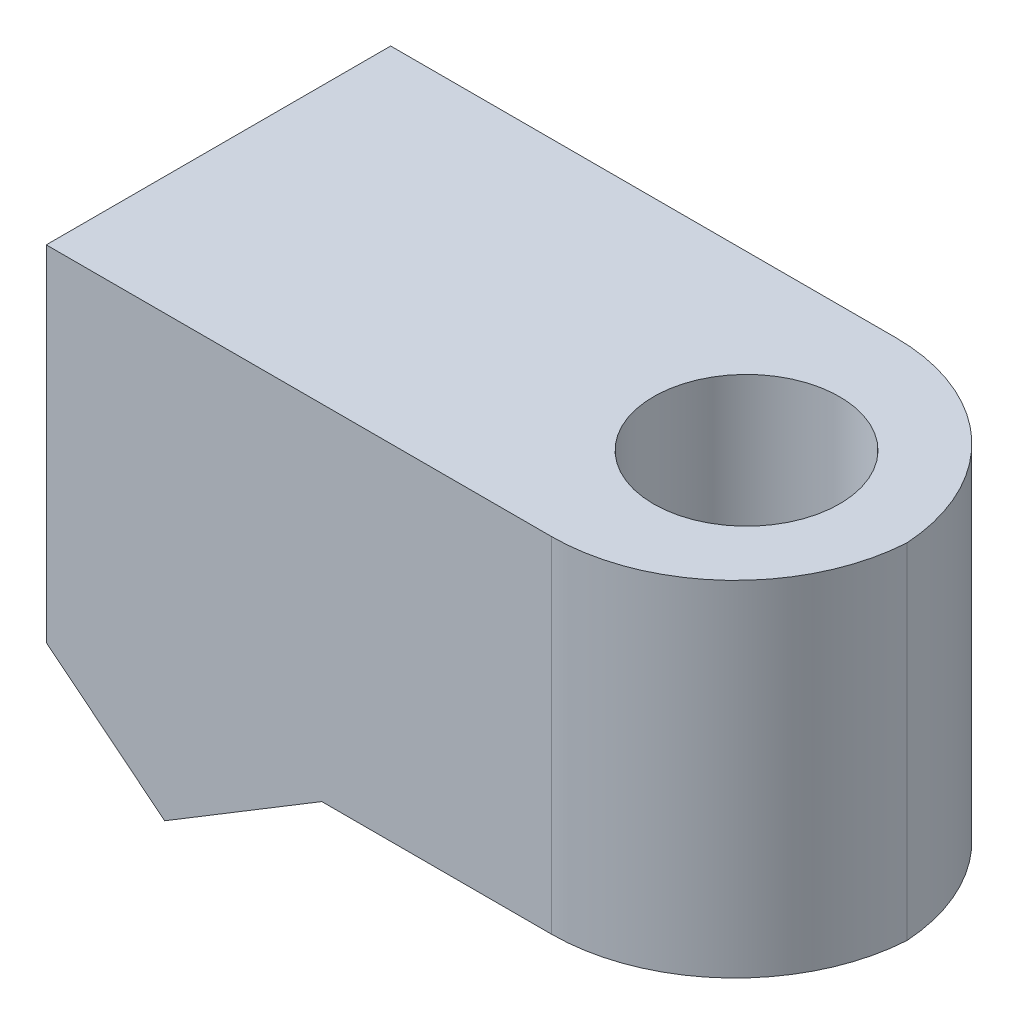
from build123d import *

# Parameters (mm, degrees)
SKETCH1_W           = 30
SKETCH1_H           = 15
SKETCH1_R           = 4.05
BOSS_EXTRUDE1_DEPTH = 15
FILLET1_R           = 8
SKETCH2_W           = 10.1
SKETCH2_H           = 10.1
CUT_EXTRUDE1_DEPTH  = 17
BOSS_EXTRUDE2_DEPTH = 15
CUT_EXTRUDE2_REACH  = 24.191
SKETCH4_R           = 3.2


with BuildPart() as part:
    # Sketch1 → Boss-Extrude1 (new body)
    with BuildSketch(Plane(origin=(0, 0, 0), x_dir=(1, 0, 0), z_dir=(0, 1, 0))):
        Rectangle(SKETCH1_W, SKETCH1_H)
        with Locations(Location((8, 0, 0), (0, 0, 270))):
            Circle(SKETCH1_R, mode=Mode.SUBTRACT)
    extrude(amount=BOSS_EXTRUDE1_DEPTH)

    # Fillet1
    # the kernel refuses this fillet: 8 mm, written as the material it takes off along each edge
    with BuildSketch(Plane(origin=(15, -20, -7.5), x_dir=(-1, 0, 0), z_dir=(0, 1, 0))) as fillet1_piece_1:
        with BuildLine():
            CenterArc((FILLET1_R, FILLET1_R), FILLET1_R, 180, 90)
            Line((0, FILLET1_R), (0, 0))
            Line((0, 0), (FILLET1_R, 0))
        make_face()
    extrude(amount=55, mode=Mode.SUBTRACT)
    with BuildSketch(Plane(origin=(15, -20, 7.5), x_dir=(-1, 0, 0), z_dir=(0, 1, 0))) as fillet1_piece_2:
        with BuildLine():
            CenterArc((FILLET1_R, -FILLET1_R), FILLET1_R, 90, 90)
            Line((0, -FILLET1_R), (0, 0))
            Line((0, 0), (FILLET1_R, 0))
        make_face()
    extrude(amount=55, mode=Mode.SUBTRACT)

    # Sketch2 → Cut-Extrude1 (cut)
    with BuildSketch(Plane.ZY.offset(15)):
        with Locations((0, 7.5)):
            Rectangle(SKETCH2_W, SKETCH2_H)
    extrude(amount=-CUT_EXTRUDE1_DEPTH, mode=Mode.SUBTRACT)

    # Sketch3 → Boss-Extrude2 (add)
    with BuildSketch(Plane.XY.offset(7.5)):
        Polygon((-3, 0), (-9.842158581, -4.145463298), (-15, 0), align=None)
    extrude(amount=-BOSS_EXTRUDE2_DEPTH)

    # Cut-Extrude2: up to this plane
    cut_extrude2_end = Plane(origin=(2, 2.45, 5.05), z_dir=(0, -1, 0))
    # Sketch4 → Cut-Extrude2 (cut, up to the surface)
    with BuildSketch(Plane(origin=(-0.805540592, 1.329558622, 0), x_dir=(0, 0, -1), z_dir=(0.5181829122191232, -0.8552698226198026, 0)), mode=Mode.PRIVATE) as cut_extrude2_sk1:
        with Locations(Location((0, -6.565809468, 0), (0, 0, 90))):
            Circle(SKETCH4_R)
    cut_extrude2_tool1 = split(extrude(cut_extrude2_sk1.sketch, amount=-CUT_EXTRUDE2_REACH, mode=Mode.PRIVATE), bisect_by=cut_extrude2_end, keep=Keep.BOTH, mode=Mode.PRIVATE)
    add(cut_extrude2_tool1.solids().sort_by_distance((-6.421079, -2.072732, 0))[0], mode=Mode.SUBTRACT)


solid = part.part
